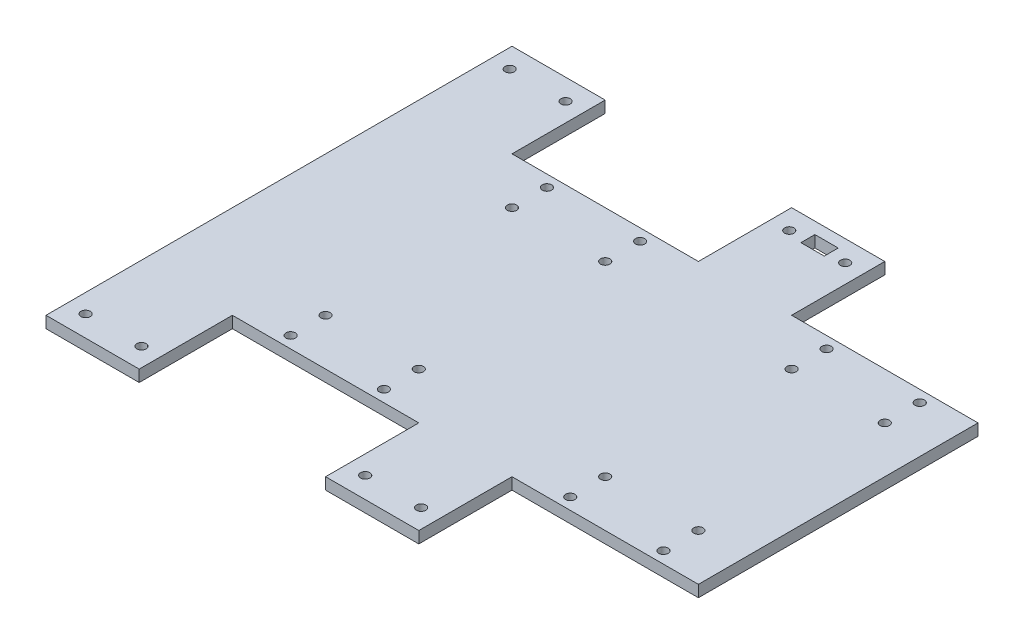
from build123d import *

# Parameters (mm, degrees)
BOSS_EXTRUDE1_DEPTH = 6.35
SKETCH2_W           = 12.7
SKETCH2_H           = 7.62
CUT_EXTRUDE1_DEPTH  = 326.340686819
SKETCH3_R           = 2.54
CUT_EXTRUDE2_DEPTH  = 326.340686819


with BuildPart() as part:
    # Sketch1 → Boss-Extrude1 (new body)
    with BuildSketch(Plane(origin=(0, 0, 0), x_dir=(1, 0, 0), z_dir=(0, 1, 0))):
        Polygon((0, 152.4), (101.6, 152.4), (101.6, 203.2), (152.4, 203.2), (152.4, 152.4), (254, 152.4), (254, 0), (152.4, 0), (152.4, -50.8), (101.6, -50.8), (101.6, 0), (0, 0), (0, -50.8), (-50.8, -50.8), (-50.8, 203.2), (0, 203.2), align=None)
    extrude(amount=BOSS_EXTRUDE1_DEPTH)

    # Sketch2 → Cut-Extrude1 (cut, through all)
    with BuildSketch(Plane(origin=(0, 6.35, 0), x_dir=(1, 0, 0), z_dir=(0, 1, 0))):
        with Locations((127, 193.04)):
            Rectangle(SKETCH2_W, SKETCH2_H)
    extrude(amount=-CUT_EXTRUDE1_DEPTH, mode=Mode.SUBTRACT)

    # Sketch3 → Cut-Extrude2 (cut, through all)
    with BuildSketch(Plane.XZ):
        with Locations((228.6, -146.05)):
            Circle(SKETCH3_R)
        with Locations((177.8, -146.05)):
            Circle(SKETCH3_R)
        with Locations((228.6, -127)):
            Circle(SKETCH3_R)
        with Locations((177.8, -127)):
            Circle(SKETCH3_R)
        with Locations((177.8, -25.4)):
            Circle(SKETCH3_R)
        with Locations((228.6, -25.4)):
            Circle(SKETCH3_R)
        with Locations((177.8, -6.35)):
            Circle(SKETCH3_R)
        with Locations((228.6, -6.35)):
            Circle(SKETCH3_R)
        with Locations((25.4, -6.35)):
            Circle(SKETCH3_R)
        with Locations((76.2, -6.35)):
            Circle(SKETCH3_R)
        with Locations((25.4, -25.4)):
            Circle(SKETCH3_R)
        with Locations((76.2, -25.4)):
            Circle(SKETCH3_R)
        with Locations((76.2, -127)):
            Circle(SKETCH3_R)
        with Locations((25.4, -127)):
            Circle(SKETCH3_R)
        with Locations((76.2, -146.05)):
            Circle(SKETCH3_R)
        with Locations((25.4, -146.05)):
            Circle(SKETCH3_R)
        with Locations((142.24, -191.77)):
            Circle(SKETCH3_R)
        with Locations((111.76, -191.77)):
            Circle(SKETCH3_R)
        with Locations((142.24, 39.37)):
            Circle(SKETCH3_R)
        with Locations((111.76, 39.37)):
            Circle(SKETCH3_R)
        with Locations((-10.16, 39.37)):
            Circle(SKETCH3_R)
        with Locations((-40.64, 39.37)):
            Circle(SKETCH3_R)
        with Locations((-10.16, -191.77)):
            Circle(SKETCH3_R)
        with Locations((-40.64, -191.77)):
            Circle(SKETCH3_R)
    extrude(amount=-CUT_EXTRUDE2_DEPTH, mode=Mode.SUBTRACT)


solid = part.part
